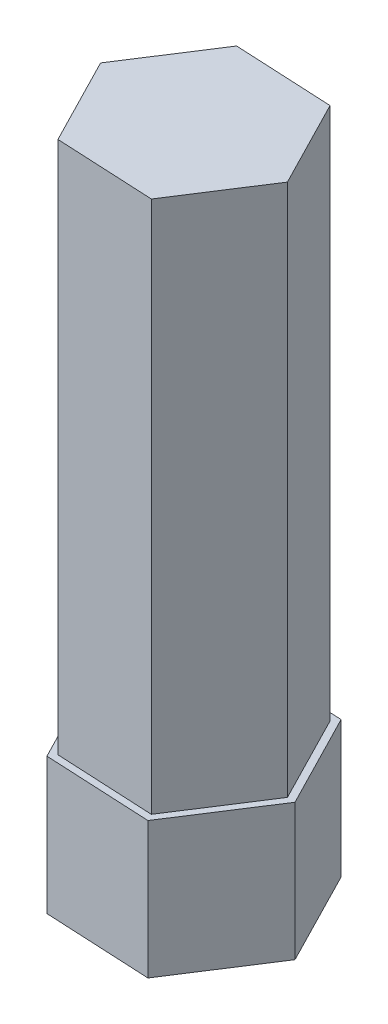
from build123d import *

# Parameters (mm, degrees)
BOSS_EXTRUDE1_DEPTH = 131.3
BOSS_EXTRUDE2_DEPTH = 33.6


with BuildPart() as part:
    # Sketch2 → Boss-Extrude1 (new body)
    with BuildSketch(Plane(origin=(0, 0, 0), x_dir=(1, 0, 0), z_dir=(0, 1, 0))):
        Polygon((13.151071984, 20.372758912), (-11.067790771, 21.575541881), (-24.218862755, 1.202782969), (-13.151071984, -20.372758912), (11.067790771, -21.575541881), (24.218862755, -1.202782969), align=None)
    extrude(amount=BOSS_EXTRUDE1_DEPTH)

    # Sketch3 → Boss-Extrude2 (add)
    with BuildSketch(Plane.XZ):
        Polygon((11.963754785, 23.322133367), (-14.215682573, 22.021982252), (-26.179437359, -1.300151114), (-11.963754785, -23.322133367), (14.215682573, -22.021982252), (26.179437359, 1.300151114), align=None)
    extrude(amount=BOSS_EXTRUDE2_DEPTH)


solid = part.part
